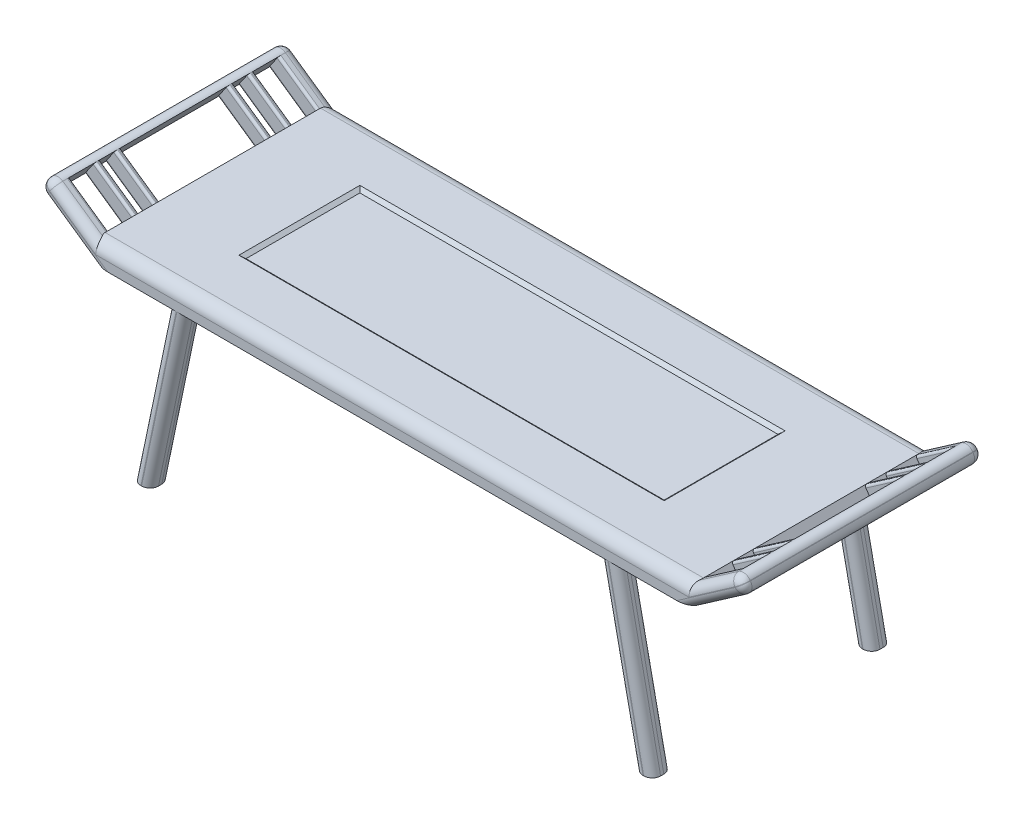
from build123d import *

# Parameters (mm, degrees)
EXTRUDE_1_DEPTH     = 400
CUT_EXTRUDE_1_DEPTH = 400
FILLET_1_R          = 20
FILLET_2_R          = 20
FILLET_3_R          = 14
FILLET_4_R          = 14
FILLET_5_R          = 14
FILLET_6_R          = 14
FILLET_7_R          = 14
FILLET_8_R          = 14
CUT_EXTRUDE_2_DEPTH = 400
FILLET_9_R          = 4
FILLET_10_R         = 4
FILLET_11_R         = 4
FILLET_12_R         = 4
SKETCH_7_W          = 710.6612262070571
SKETCH_7_H          = 202.1492180553622
CUT_EXTRUDE_3_DEPTH = 5
CUT_EXTRUDE_3_DRAFT = -50.00000000000011
SKETCH_9_R          = 59.82504471589636
CUT_EXTRUDE_4_DEPTH = 1


with BuildPart() as part:
    # 草图2 → 凸台-拉伸1 (new body)
    with BuildSketch(Plane.XY):
        Polygon((-576.1112633870362, 70.4335703854848), (-499.99999999999994, 17.50000000000015), (500, 17.500000000000004), (576.1112633870362, 70.4335703854848), (592.517462490044, 46.84369099485134), (500, -17.499999999999996), (375.43695113297224, -17.499999999999996), (434.3541291384656, -298.9116927542242), (404.72536916937304, -298.9116927542242), (345.8081911638796, -17.5), (-345.8081911638796, -17.5), (-404.72536916937304, -298.9116927542242), (-434.3541291384656, -298.9116927542242), (-375.43695113297224, -17.499999999999996), (-500, -17.499999999999996), (-592.5174624900441, 46.843690994851194), align=None)
    extrude(amount=EXTRUDE_1_DEPTH)

    # 草图5 → 切除-拉伸1 (cut)
    with BuildSketch(Plane(origin=(356.1615289345543, 74.56702311681332, 0), x_dir=(0, 0, -1), z_dir=(0.9787787281766595, 0.20491998748018975, 0))):
        Polygon((-33.42068696760769, -381.57624917613504), (-33.42068696760769, -94.06316306886082), (-366.57931303239235, -94.06316306886103), (-366.57931303239235, -381.57624917613504), align=None)
    cut_extrude_1 = extrude(amount=-CUT_EXTRUDE_1_DEPTH, mode=Mode.SUBTRACT)

    # 镜向1: 切除-拉伸1 across plane
    add(cut_extrude_1.mirror(Plane.ZY), mode=Mode.SUBTRACT)

    # 圆角1
    fillet_1_edges = [part.edges().sort_by_distance(p)[0] for p in [
        (5.684e-14, 17.500000000000078, 400),
    ]]
    fillet(fillet_1_edges, radius=FILLET_1_R)

    # 圆角2
    fillet_2_edges = [part.edges().sort_by_distance(p)[0] for p in [
        (5.684e-14, 17.500000000000078, 0),
    ]]
    fillet(fillet_2_edges, radius=FILLET_2_R)

    # 圆角3
    fillet_3_edges = [part.edges().sort_by_distance(p)[0] for p in [
        (-576.1112633870362, 70.4335703854848, 200),
        (576.1112633870362, 70.4335703854848, 200),
        (592.517462490044, 46.84369099485134, 200),
        (-592.5174624900441, 46.843690994851194, 200),
    ]]
    fillet(fillet_3_edges, radius=FILLET_3_R)

    # 圆角4
    fillet_4_edges = [part.edges().sort_by_distance(p)[0] for p in [
        (575.0861132696524, 64.72591317901423, 0),
        (584.3143629385401, 58.63863069016801, 0),
        (586.8098052835735, 47.868841112235096, 0),
        (-586.8098052835734, 47.86884111223492, 0),
        (-584.3143629385402, 58.63863069016799, 0),
        (-575.0861132696524, 64.72591317901423, 0),
        (586.8098052835735, 47.868841112235096, 400),
        (584.3143629385401, 58.63863069016801, 400),
        (575.0861132696524, 64.72591317901423, 400),
        (-586.8098052835734, 47.86884111223492, 400),
        (-584.3143629385402, 58.63863069016799, 400),
        (-575.0861132696524, 64.72591317901423, 400),
        (517.9301834149, 29.97001539037533, -1.97e-15),
        (540.511920725535, 10.67507569505863, 0),
        (-540.511920725535, 10.67507569505851, 0),
        (-517.9301834148998, 29.970015390375412, -1.97e-15),
        (540.511920725535, 10.67507569505863, 400),
        (517.9301834149, 29.97001539037533, 400),
        (-540.511920725535, 10.67507569505851, 400),
        (-517.9301834148998, 29.970015390375423, 400),
    ]]
    fillet(fillet_4_edges, radius=FILLET_4_R)

    # 圆角5
    fillet_5_edges = [part.edges().sort_by_distance(p)[0] for p in [
        (-404.89554013571893, -158.2058463771121, 400),
        (-375.2667801666263, -158.2058463771121, 400),
        (-375.88886859261106, -161.1771861955749, 366.57931303239235),
        (-404.8955401357191, -158.20584637711215, 366.57931303239235),
    ]]
    fillet(fillet_5_edges, radius=FILLET_5_R)

    # 圆角6
    # the kernel refuses this fillet: 14 mm, written as the material it takes off along each edge
    with BuildSketch(Plane(origin=(-338.635991602073, 16.757255486183084, 0), x_dir=(-0.9787787281766592, 0.20491998748019008, 0), z_dir=(-0.20491998748019008, -0.9787787281766593, 0))) as fillet_6_piece_1_section:
        with BuildLine():
            CenterArc((FILLET_6_R, -FILLET_6_R), FILLET_6_R, 90, 90)
            Line((0, -FILLET_6_R), (0, 0))
            Line((0, 0), (FILLET_6_R, 0))
        make_face()
    fillet_6_piece_1 = extrude(amount=357.5130861072742, mode=Mode.PRIVATE)
    fillet_6_piece_1 = split(fillet_6_piece_1, bisect_by=Plane(origin=(-382.0172136715201, -17.5, 3.1730322725912052), z_dir=(0, -1, 0)), keep=Keep.TOP, mode=Mode.PRIVATE)
    add(fillet_6_piece_1, mode=Mode.SUBTRACT)
    with BuildSketch(Plane(origin=(-441.52632870027224, -333.16894824040725, 0), x_dir=(8.1e-16, -1.7e-16, 1), z_dir=(0.20491998748018989, 0.9787787281766593, 0))) as fillet_6_piece_2_section:
        with BuildLine():
            CenterArc((FILLET_6_R, FILLET_6_R), FILLET_6_R, 180, 89.99999999999994)
            Line((9.87e-15, FILLET_6_R), (0, 0))
            Line((0, 0), (FILLET_6_R, 0))
        make_face()
    fillet_6_piece_2 = extrude(amount=357.51308610727415, mode=Mode.PRIVATE)
    fillet_6_piece_2 = split(fillet_6_piece_2, bisect_by=Plane(origin=(-405.30547645940067, -17.499999999999996, 3.1660453028253226), z_dir=(0, -1, 0)), keep=Keep.TOP, mode=Mode.PRIVATE)
    add(fillet_6_piece_2, mode=Mode.SUBTRACT)
    with BuildSketch(Plane(origin=(-347.0523680158491, -23.442679636925448, 33.42068696760769), x_dir=(-0.9787787281766593, 0.20491998748019008, 0), z_dir=(-0.20491998748019008, -0.9787787281766593, 0))) as fillet_6_piece_3:
        with BuildLine():
            CenterArc((FILLET_6_R, FILLET_6_R), FILLET_6_R, 180, 90)
            Line((1.46e-15, FILLET_6_R), (0, 0))
            Line((0, 0), (FILLET_6_R, 0))
        make_face()
    extrude(amount=316.44156098535433, mode=Mode.SUBTRACT)
    with BuildSketch(Plane(origin=(-441.5263287002723, -333.1689482404073, 33.42068696760769), x_dir=(0.9787787281766593, -0.20491998748019002, 0), z_dir=(0.20491998748019005, 0.9787787281766595, 0))) as fillet_6_piece_4:
        with BuildLine():
            CenterArc((FILLET_6_R, FILLET_6_R), FILLET_6_R, 180, 90)
            Line((0, FILLET_6_R), (0, 0))
            Line((0, 0), (FILLET_6_R, 0))
        make_face()
    extrude(amount=322.5130861072744, mode=Mode.SUBTRACT)

    # 圆角7
    fillet_7_edges = [part.edges().sort_by_distance(p)[0] for p in [
        (375.2667801666263, -158.2058463771121, 400),
        (404.89554013571893, -158.20584637711212, 400),
        (375.88886859261106, -161.17718619557496, 366.57931303239235),
        (404.89554013571905, -158.20584637711224, 366.57931303239235),
    ]]
    fillet(fillet_7_edges, radius=FILLET_7_R)

    # 圆角8
    # the kernel refuses this fillet: 14 mm, written as the material it takes off along each edge
    with BuildSketch(Plane(origin=(368.2647515711656, 16.75725548618307, 0), x_dir=(-0.9787787281766592, -0.20491998748018989, 0), z_dir=(0.2049199874801899, -0.9787787281766595, 0))) as fillet_8_piece_1_section:
        with BuildLine():
            CenterArc((FILLET_8_R, -FILLET_8_R), FILLET_8_R, 90, 90)
            Line((-4.37e-15, -FILLET_8_R), (0, 0))
            Line((0, 0), (FILLET_8_R, 0))
        make_face()
    fillet_8_piece_1 = extrude(amount=357.51308610727426, mode=Mode.PRIVATE)
    fillet_8_piece_1 = split(fillet_8_piece_1, bisect_by=Plane(origin=(405.3054764594067, -17.499999999999996, 3.166045302824929), z_dir=(0, -1, 0)), keep=Keep.TOP, mode=Mode.PRIVATE)
    add(fillet_8_piece_1, mode=Mode.SUBTRACT)
    with BuildSketch(Plane(origin=(411.89756873117966, -333.1689482404073, 0), x_dir=(0.9787787281766593, 0.20491998748019008, 0), z_dir=(-0.20491998748019008, 0.9787787281766593, 0))) as fillet_8_piece_2_section:
        with BuildLine():
            CenterArc((FILLET_8_R, -FILLET_8_R), FILLET_8_R, 90, 90)
            Line((1.165e-14, -FILLET_8_R), (0, 0))
            Line((0, 0), (FILLET_8_R, 0))
        make_face()
    fillet_8_piece_2 = extrude(amount=357.5130861072742, mode=Mode.PRIVATE)
    fillet_8_piece_2 = split(fillet_8_piece_2, bisect_by=Plane(origin=(382.017213671516, -17.5, 3.1730322725914113), z_dir=(0, -1, 0)), keep=Keep.TOP, mode=Mode.PRIVATE)
    add(fillet_8_piece_2, mode=Mode.SUBTRACT)
    with BuildSketch(Plane(origin=(347.05236801584914, -23.442679636925504, 33.42068696760769), x_dir=(0.9787787281766593, 0.20491998748019005, 0), z_dir=(0.20491998748019008, -0.9787787281766593, 0))) as fillet_8_piece_3:
        with BuildLine():
            CenterArc((FILLET_8_R, -FILLET_8_R), FILLET_8_R, 90, 90)
            Line((1.46e-15, -FILLET_8_R), (0, 0))
            Line((0, 0), (FILLET_8_R, 0))
        make_face()
    extrude(amount=316.4415609853543, mode=Mode.SUBTRACT)
    with BuildSketch(Plane(origin=(441.5263287002725, -333.1689482404071, 33.42068696760769), x_dir=(-0.9787787281766595, -0.20491998748018977, 0), z_dir=(-0.20491998748018975, 0.9787787281766595, 0))) as fillet_8_piece_4:
        with BuildLine():
            CenterArc((FILLET_8_R, -FILLET_8_R), FILLET_8_R, 90, 90)
            Line((-4.399e-14, -FILLET_8_R), (0, 0))
            Line((0, 0), (FILLET_8_R, 0))
        make_face()
    extrude(amount=322.51308610727426, mode=Mode.SUBTRACT)

    # 草图6 → 切除-拉伸2 (cut)
    with BuildSketch(Plane(origin=(154.7986234394469, -222.57933320479648, 0), x_dir=(0.8209729313552904, 0.5709671146238648, 0), z_dir=(-0.5709671146238648, 0.8209729313552904, 0))):
        Polygon((420.47839018356274, -66.97563038576293), (499.18700514531184, -66.97563038576298), (499.18700514531184, -25.60863091549237), (420.47839018356274, -25.608630915492313), align=None)
        Polygon((420.47839018356274, -76.52186103274843), (499.18700514531184, -76.52186103274849), (499.18700514531184, -101.34206071491086), (420.47839018356274, -101.34206071491082), align=None)
        Polygon((420.47839018356274, -110.88829136189632), (499.18700514531184, -110.88829136189638), (499.18700514531184, -289.1117086381038), (420.47839018356274, -289.11170863810383), align=None)
        Polygon((420.47839018356274, -374.3913690845078), (499.18700514531184, -374.39136908450774), (499.18700514531184, -333.0243696142372), (420.47839018356274, -333.02436961423723), align=None)
        Polygon((420.47839018356274, -323.4781389672517), (499.18700514531184, -323.47813896725165), (499.18700514531184, -298.65793928508924), (420.47839018356274, -298.6579392850893), align=None)
    cut_extrude_2 = extrude(amount=-CUT_EXTRUDE_2_DEPTH, mode=Mode.SUBTRACT)

    # 镜向3: 切除-拉伸2 across plane
    add(cut_extrude_2.mirror(Plane.ZY), mode=Mode.SUBTRACT)

    # 圆角9
    fillet_9_edges = [part.edges().sort_by_distance(p)[0] for p in [
        (548.7150202770389, 16.380135999741917, 25.608630915492345),
        (548.7150202770389, 16.380135999741896, 66.97563038576297),
        (532.308821174031, 39.970015390375266, 66.97563038576295),
        (532.308821174031, 39.970015390375266, 25.60863091549234),
        (548.7150202770389, 16.380135999741896, 76.52186103274848),
        (548.7150202770389, 16.380135999741903, 101.34206071491084),
        (532.308821174031, 39.970015390375266, 101.34206071491084),
        (532.308821174031, 39.970015390375266, 76.52186103274846),
        (548.7150202770389, 16.38013599974189, 110.88829136189636),
        (548.7150202770389, 16.380135999741853, 289.11170863810383),
        (532.308821174031, 39.970015390375266, 289.1117086381038),
        (532.308821174031, 39.970015390375266, 110.88829136189635),
        (548.7150202770389, 16.380135999741853, 333.02436961423723),
        (548.7150202770389, 16.38013599974185, 374.3913690845078),
        (532.308821174031, 39.970015390375266, 374.3913690845078),
        (532.308821174031, 39.970015390375266, 333.02436961423723),
        (548.7150202770389, 16.380135999741853, 298.6579392850893),
        (548.7150202770389, 16.380135999741842, 323.47813896725165),
        (532.308821174031, 39.970015390375266, 323.47813896725165),
        (532.308821174031, 39.970015390375266, 298.65793928508924),
    ]]
    fillet(fillet_9_edges, radius=FILLET_9_R)

    # 圆角10
    fillet_10_edges = [part.edges().sort_by_distance(p)[0] for p in [
        (-532.3088211740309, 39.970015390375494, 66.97563038576295),
        (-532.3088211740309, 39.970015390375266, 25.60863091549234),
        (-548.7150202770388, 16.38013599974175, 66.97563038576297),
        (-548.7150202770389, 16.38013599974175, 25.608630915492345),
        (-532.3088211740309, 39.970015390375266, 101.34206071491083),
        (-532.3088211740309, 39.970015390375494, 76.52186103274846),
        (-548.7150202770389, 16.38013599974174, 101.34206071491084),
        (-532.3088211740309, 39.970015390375266, 289.11170863810383),
        (-532.3088211740309, 39.970015390375494, 110.88829136189635),
        (-548.7150202770389, 16.380135999741743, 289.11170863810383),
        (-532.3088211740309, 39.970015390375494, 374.39136908450774),
        (-532.3088211740309, 39.970015390375266, 333.02436961423723),
        (-548.7150202770388, 16.380135999741732, 374.39136908450774),
        (-532.3088211740309, 39.970015390375494, 323.47813896725165),
        (-532.3088211740309, 39.970015390375266, 298.6579392850893),
    ]]
    fillet(fillet_10_edges, radius=FILLET_10_R)

    # 圆角11
    # the kernel refuses this fillet: 4 mm, written as the material it takes off along each edge
    with BuildSketch(Plane(origin=(-516.4061991030078, -6.089879390633527, 333.02436961423723), x_dir=(-1.28e-15, -3.11e-15, -1), z_dir=(-0.8209729313552911, 0.570967114623864, 0))) as fillet_11_piece_1:
        with BuildLine():
            CenterArc((FILLET_11_R, -FILLET_11_R), FILLET_11_R, 89.99999999999982, 90.00000000000136)
            Line((-1.313e-14, -FILLET_11_R), (0, 0))
            Line((0, 0), (FILLET_11_R, 0))
        make_face()
    extrude(amount=78.70861496174909, mode=Mode.SUBTRACT)
    with BuildSketch(Plane(origin=(-581.0238414510699, 38.85015139011705, 323.4781389672517), x_dir=(0.570967114623864, 0.820972931355291, -1.4210854715201903e-14), z_dir=(0.8209729313552911, -0.570967114623864, 0))) as fillet_11_piece_2:
        with BuildLine():
            CenterArc((FILLET_11_R, FILLET_11_R), FILLET_11_R, 180, 90.0000000000008)
            Line((-4.518e-14, FILLET_11_R), (0, 0))
            Line((0, 0), (FILLET_11_R, 0))
        make_face()
    extrude(amount=78.70861496174912, mode=Mode.SUBTRACT)
    with BuildSketch(Plane(origin=(-516.4061991030078, -6.089879390633531, 298.6579392850893), x_dir=(0.570967114623864, 0.8209729313552911, 0), z_dir=(-0.8209729313552911, 0.570967114623864, 0))) as fillet_11_piece_3:
        with BuildLine():
            CenterArc((FILLET_11_R, FILLET_11_R), FILLET_11_R, 180, 90)
            Line((1.1887e-13, FILLET_11_R), (0, 0))
            Line((0, 0), (FILLET_11_R, 0))
        make_face()
    extrude(amount=78.70861496174909, mode=Mode.SUBTRACT)

    # 圆角12
    # the kernel refuses this fillet: 4 mm, written as the material it takes off along each edge
    with BuildSketch(Plane(origin=(-581.0238414510699, 38.850151390117055, 76.5218610327485), x_dir=(-3.92e-15, -4.38e-15, -1), z_dir=(0.8209729313552911, -0.570967114623864, 0))) as fillet_12_piece_1:
        with BuildLine():
            CenterArc((FILLET_12_R, FILLET_12_R), FILLET_12_R, 179.99999999999977, 90.00000000000057)
            Line((-2.333e-14, FILLET_12_R), (0, 0))
            Line((0, 0), (FILLET_12_R, 0))
        make_face()
    extrude(amount=78.70861496174912, mode=Mode.SUBTRACT)
    with BuildSketch(Plane(origin=(-581.0238414510699, 38.85015139011705, 110.8882913618964), x_dir=(-3.09e-15, -3.18e-15, -1), z_dir=(0.8209729313552911, -0.570967114623864, 0))) as fillet_12_piece_2:
        with BuildLine():
            CenterArc((FILLET_12_R, FILLET_12_R), FILLET_12_R, 179.99999999999966, 90.00000000000057)
            Line((-1.75e-14, FILLET_12_R), (0, 0))
            Line((0, 0), (FILLET_12_R, 0))
        make_face()
    extrude(amount=78.70861496174912, mode=Mode.SUBTRACT)


with BuildPart() as cut_extrude_3_tool:
    # 草图7 → 切除-拉伸3 (with draft: the straight prism first)
    with BuildSketch(Plane(origin=(2.55e-15, 17.500000000000078, 0), x_dir=(1, -1.5e-16, 0), z_dir=(1.5e-16, 1, 0))):
        with Locations((0, -199.99999999999994)):
            Rectangle(SKETCH_7_W, SKETCH_7_H)
    extrude(amount=-CUT_EXTRUDE_3_DEPTH)
    # 切除-拉伸3: the draft: its side faces are tilted about the plane it starts from
    cut_extrude_3_sides = [cut_extrude_3_tool.faces().sort_by_distance(p)[0] for p in [
        (-355.330613104, 15, 200),
        (0, 15, 301.074609028),
        (355.330613104, 15, 200),
        (0, 15, 98.925390972),
    ]]
    draft(cut_extrude_3_sides, Plane(origin=(2.55e-15, 17.500000000000078, 0), x_dir=(1, -1.5e-16, 0), z_dir=(1.5e-16, 1, 0)), CUT_EXTRUDE_3_DRAFT)


with BuildPart() as part_1:
    add(part.part)

    # 切除-拉伸3: cut by cut_extrude_3_tool
    add(cut_extrude_3_tool.part, mode=Mode.SUBTRACT)

    # 草图9 → 切除-拉伸4 (cut)
    with BuildSketch(Plane.XZ.offset(17.5)):
        with Locations(Location((0, 200, 0), (0, 0, 270))):
            Circle(SKETCH_9_R)
    extrude(amount=-CUT_EXTRUDE_4_DEPTH, mode=Mode.SUBTRACT)


solid = part_1.part
